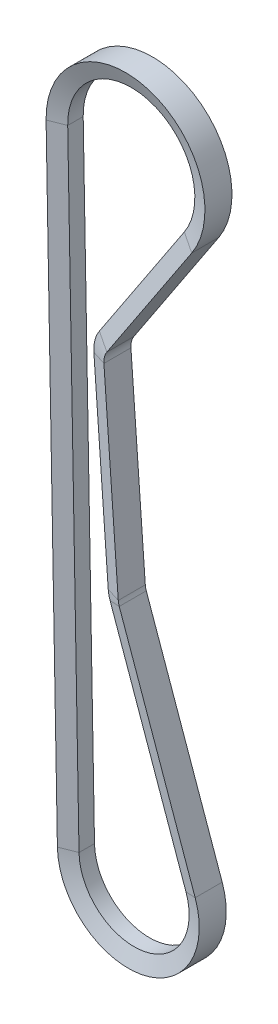
from build123d import *


with BuildPart() as part:
    # Sweep1: sweep along a path in Sketch2
    with BuildLine(Plane.XY) as sweep1_path:
        Line((-24.99589288, -0.45314359), (-28.983185699, 219.490261622))
        ThreePointArc((-28.983185699, 219.490261622), (6.838887331, 246.881665898), (22.360427981, 204.542656459))
        Line((22.360427981, 204.542656459), (-7.564091492, 159.335385104))
        ThreePointArc((-7.564091492, 159.335385104), (-8.411799808, 157.439459767), (-8.602441894, 155.37141773))
        Line((-8.602441894, 155.37141773), (-3.542978712, 85.55450121))
        ThreePointArc((-3.542978712, 85.55450121), (-3.424823348, 84.71218392), (-3.195155321, 83.893214016))
        Line((-3.195155321, 83.893214016), (23.565229614, 8.347451901))
        ThreePointArc((23.565229614, 8.347451901), (4.458062314, -24.599302437), (-24.99589288, -0.45314359))
    # Sketch3 → Sweep1 (sweep)
    with BuildSketch(Plane(origin=(23.565229614, 8.347451901, 0), x_dir=(-0.9426091845652542, -0.3338980760250449, 0), z_dir=(0.33389807602504484, -0.9426091845652541, 0))):
        Polygon((0, -4.7625), (0, 4.7625), (5.588, 2.728634331), (5.588, -2.728634331), align=None)
    sweep(path=sweep1_path.line)


solid = part.part
